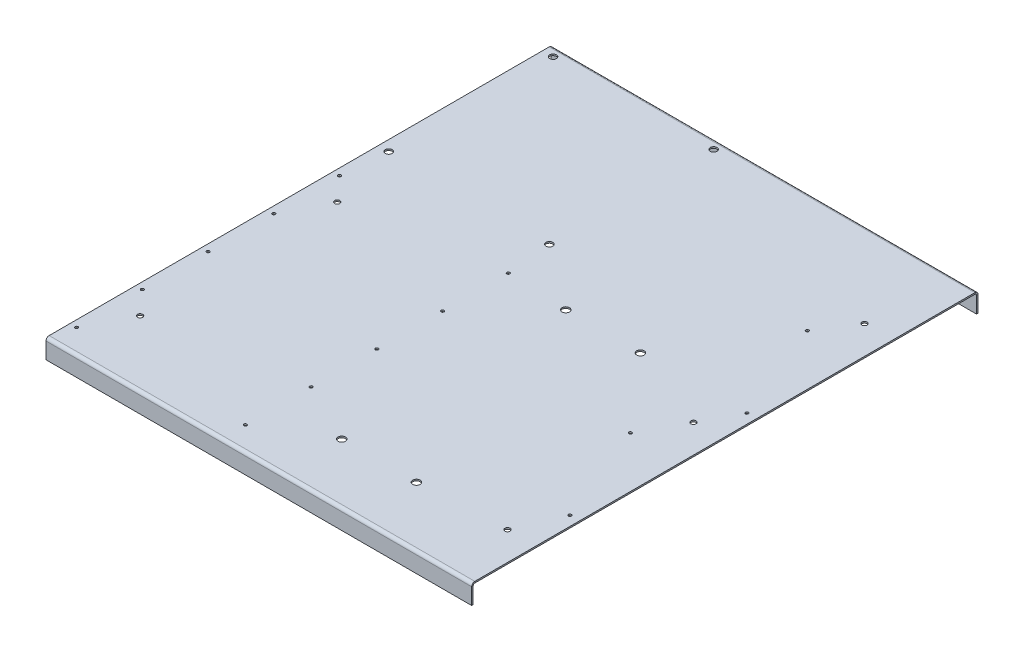
from build123d import *

# Parameters (mm, degrees)
SKETCH_1_W                         = 285
SKETCH_1_H                         = 337
SM_BASE_FLANGE_1_DEPTH             = 1
SM_EDGE_FLANGE_1_STRIP_W           = 6.2
SM_EDGE_FLANGE_1_STRIP_H           = 1
SM_EDGE_FLANGE_1_STRIP_CUT_DEPTH   = 285
SM_EDGE_FLANGE_1_STRIP_2_W         = 6.2
SM_EDGE_FLANGE_1_STRIP_2_H         = 1
SM_EDGE_FLANGE_1_STRIP_CUT_2_DEPTH = 285
SM_EDGE_FLANGE_1_DEPTH             = 285
SM_EDGE_FLANGE_1_BEND_DEPTH        = 285
SKETCH_10_R                        = 1
CUT_EXTRUDE_1_DEPTH                = 10
SKETCH_11_R                        = 2.25
CUT_EXTRUDE_2_DEPTH                = 3
SKETCH_12_R                        = 1.75
CUT_EXTRUDE_3_DEPTH                = 3
SKETCH_13_R                        = 2.5
CUT_EXTRUDE_4_DEPTH                = 10


# Sheet-metal steps are written as plain solids
with BuildPart() as part:
    # Sketch 1 → Базовая кромка1 (new body)
    with BuildSketch(Plane(origin=(0, 0, 0), x_dir=(1, 0, 0), z_dir=(0, 1, 0))):
        with Locations((110.522140356, -133.470311428)):
            Rectangle(SKETCH_1_W, SKETCH_1_H)
    extrude(amount=-SM_BASE_FLANGE_1_DEPTH)

    # Ребро-кромка1 strip (across the edge) → Ребро-кромка1 strip cut (cut)
    with BuildSketch(Plane(origin=(253.022140356, -1, 301.970311428), x_dir=(0, 0, -1), z_dir=(-1, 0, 0))):
        with Locations((-2, -0.5)):
            Rectangle(SM_EDGE_FLANGE_1_STRIP_W, SM_EDGE_FLANGE_1_STRIP_H)
    extrude(amount=SM_EDGE_FLANGE_1_STRIP_CUT_DEPTH, mode=Mode.SUBTRACT)

    # Ребро-кромка1 strip 2 (across the edge) → Ребро-кромка1 strip cut 2 (cut)
    with BuildSketch(Plane(origin=(-31.977859644, -1, -35.029688572), x_dir=(0, 0, 1), z_dir=(1, 0, 0))):
        with Locations((-2, -0.5)):
            Rectangle(SM_EDGE_FLANGE_1_STRIP_2_W, SM_EDGE_FLANGE_1_STRIP_2_H)
    extrude(amount=SM_EDGE_FLANGE_1_STRIP_CUT_2_DEPTH, mode=Mode.SUBTRACT)

    # Ребро-кромка1 section (across the edge) → Ребро-кромка1 (add)
    with BuildSketch(Plane(origin=(253.022140356, -1, 301.970311428), x_dir=(0, 0, -1), z_dir=(-1, 0, 0))):
        with BuildLine():
            Line((-1, 1.1), (-1, 12))
            Line((-1, 12), (0, 12))
            Line((0, 12), (0, 1.1))
            ThreePointArc((0, 1.1), (0.322182541, 0.322182541), (1.1, 0))
            Line((1.1, 0), (1.1, -1))
            ThreePointArc((1.1, -1), (-0.38492424, -0.38492424), (-1, 1.1))
        make_face()
    extrude(amount=SM_EDGE_FLANGE_1_DEPTH)

    # Ребро-кромка1 section 2 (across the edge) → Ребро-кромка1 bend (add)
    with BuildSketch(Plane(origin=(-31.977859644, -1, -35.029688572), x_dir=(0, 0, 1), z_dir=(1, 0, 0))):
        with BuildLine():
            Line((-1, 1.1), (-1, 12))
            Line((-1, 12), (0, 12))
            Line((0, 12), (0, 1.1))
            ThreePointArc((0, 1.1), (0.322182541, 0.322182541), (1.1, 0))
            Line((1.1, 0), (1.1, -1))
            ThreePointArc((1.1, -1), (-0.38492424, -0.38492424), (-1, 1.1))
        make_face()
    extrude(amount=SM_EDGE_FLANGE_1_BEND_DEPTH)

    # Эскиз10 → Вырез-Вытянуть1 (cut)
    with BuildSketch(Plane(origin=(0, 0, 0), x_dir=(1, 0, 0), z_dir=(0, 1, 0))):
        with Locations(Location((-27.477859644, -110.970311428, 0), (0, 0, 270))):
            Circle(SKETCH_10_R)
        with Locations(Location((85.522140356, -110.970311428, 0), (0, 0, 270))):
            Circle(SKETCH_10_R)
        with Locations(Location((85.522140356, -154.970311428, 0), (0, 0, 270))):
            Circle(SKETCH_10_R)
        with Locations(Location((-27.477859644, -154.970311428, 0), (0, 0, 270))):
            Circle(SKETCH_10_R)
        with Locations(Location((-27.477859644, -198.970311428, 0), (0, 0, 270))):
            Circle(SKETCH_10_R)
        with Locations(Location((85.522140356, -198.970311428, 0), (0, 0, 270))):
            Circle(SKETCH_10_R)
        with Locations(Location((-27.477859644, -242.970311428, 0), (0, 0, 270))):
            Circle(SKETCH_10_R)
        with Locations(Location((85.522140356, -242.970311428, 0), (0, 0, 270))):
            Circle(SKETCH_10_R)
        with Locations(Location((85.522140356, -286.970311428, 0), (0, 0, 270))):
            Circle(SKETCH_10_R)
        with Locations(Location((-27.477859644, -286.970311428, 0), (0, 0, 270))):
            Circle(SKETCH_10_R)
        with Locations(Location((246.522140356, -230.720311428, 0), (0, 0, 270))):
            Circle(SKETCH_10_R)
        with Locations(Location((219.022140356, -162.720311428, 0), (0, 0, 270))):
            Circle(SKETCH_10_R)
        with Locations(Location((246.522140356, -112.220311428, 0), (0, 0, 270))):
            Circle(SKETCH_10_R)
        with Locations(Location((219.022140356, -44.220311428, 0), (0, 0, 270))):
            Circle(SKETCH_10_R)
    extrude(amount=-CUT_EXTRUDE_1_DEPTH, mode=Mode.SUBTRACT)

    # Эскиз11 → Вырез-Вытянуть2 (cut)
    with BuildSketch(Plane(origin=(0, 0, 0), x_dir=(1, 0, 0), z_dir=(0, 1, 0))):
        with Locations(Location((82.522140356, 29.529688572, 0), (0, 0, 270))):
            Circle(SKETCH_11_R)
        with Locations(Location((82.522140356, -80.470311428, 0), (0, 0, 270))):
            Circle(SKETCH_11_R)
        with Locations(Location((-24.977859644, -80.470311428, 0), (0, 0, 270))):
            Circle(SKETCH_11_R)
        with Locations(Location((-24.977859644, 29.529688572, 0), (0, 0, 270))):
            Circle(SKETCH_11_R)
    extrude(amount=-CUT_EXTRUDE_2_DEPTH, mode=Mode.SUBTRACT)

    # Эскиз12 → Вырез-Вытянуть3 (cut)
    with BuildSketch(Plane(origin=(0, 0, 0), x_dir=(1, 0, 0), z_dir=(0, 1, 0))):
        with Locations(Location((-12.977859644, -126.970311428, 0), (0, 0, 270))):
            Circle(SKETCH_12_R)
        with Locations(Location((234.022140356, -20.970311428, 0), (0, 0, 270))):
            Circle(SKETCH_12_R)
        with Locations(Location((234.022140356, -135.470311428, 0), (0, 0, 270))):
            Circle(SKETCH_12_R)
        with Locations(Location((-12.977859644, -258.970311428, 0), (0, 0, 270))):
            Circle(SKETCH_12_R)
        with Locations(Location((234.022140356, -259.970311428, 0), (0, 0, 270))):
            Circle(SKETCH_12_R)
    extrude(amount=-CUT_EXTRUDE_3_DEPTH, mode=Mode.SUBTRACT)

    # Эскиз13 → Вырез-Вытянуть4 (cut)
    with BuildSketch(Plane.XZ.offset(1)):
        with Locations(Location((126.022140356, 262.970311428, 0), (0, 0, 270))):
            Circle(SKETCH_13_R)
        with Locations(Location((176.022140356, 262.970311428, 0), (0, 0, 270))):
            Circle(SKETCH_13_R)
        with Locations(Location((126.022140356, 112.970311428, 0), (0, 0, 270))):
            Circle(SKETCH_13_R)
        with Locations(Location((176.022140356, 112.970311428, 0), (0, 0, 270))):
            Circle(SKETCH_13_R)
    extrude(amount=-CUT_EXTRUDE_4_DEPTH, mode=Mode.SUBTRACT)


solid = part.part
